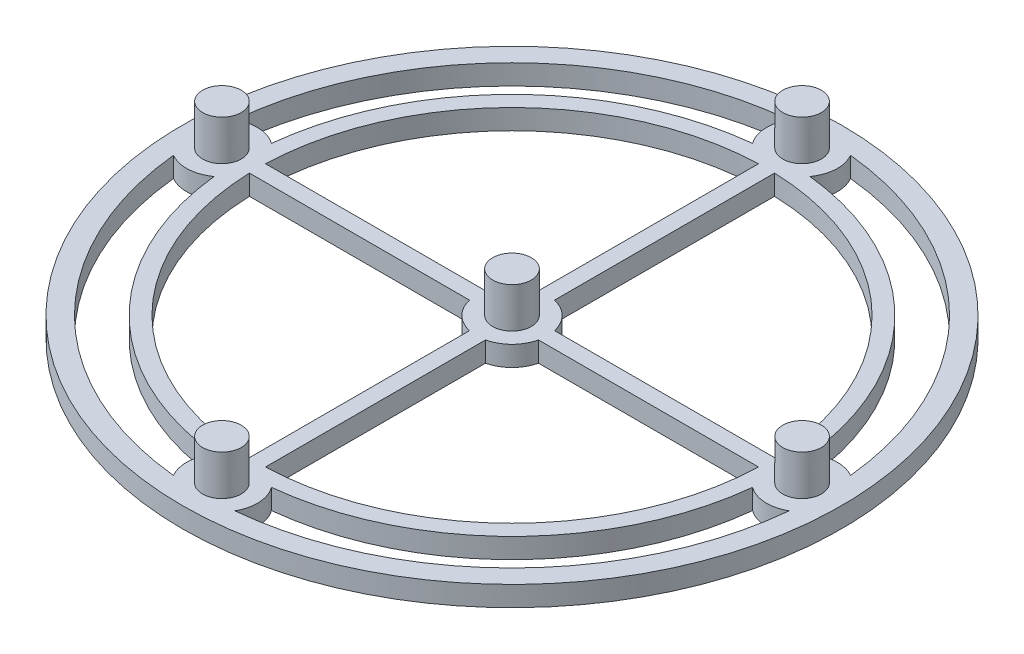
from build123d import *

# Parameters (mm, degrees)
SKETCH1_R             = 4.8
BOSS_EXTRUDE1_DEPTH   = 15
BOSS_EXTRUDE1_2_DEPTH = 15
BOSS_EXTRUDE1_3_DEPTH = 15
BOSS_EXTRUDE1_4_DEPTH = 15
BOSS_EXTRUDE1_5_DEPTH = 15
SKETCH2_R             = 81.8
BOSS_EXTRUDE2_DEPTH   = 5


with BuildPart() as part:
    # Sketch1 → Boss-Extrude1 (new body)
    with BuildSketch(Plane(origin=(0, 0, 0), x_dir=(1, 0, 0), z_dir=(0, 1, 0))):
        with Locations((0, 72)):
            Circle(SKETCH1_R)
    extrude(amount=BOSS_EXTRUDE1_DEPTH)



with BuildPart() as body_2:
    # Sketch1 → Boss-Extrude1 2 (new body)
    with BuildSketch(Plane(origin=(0, 0, 0), x_dir=(1, 0, 0), z_dir=(0, 1, 0))):
        Circle(SKETCH1_R)
    extrude(amount=BOSS_EXTRUDE1_2_DEPTH)


with BuildPart() as body_3:
    # Sketch1 → Boss-Extrude1 3 (new body)
    with BuildSketch(Plane(origin=(0, 0, 0), x_dir=(1, 0, 0), z_dir=(0, 1, 0))):
        with Locations((72, 0)):
            Circle(SKETCH1_R)
    extrude(amount=BOSS_EXTRUDE1_3_DEPTH)


with BuildPart() as body_4:
    # Sketch1 → Boss-Extrude1 4 (new body)
    with BuildSketch(Plane(origin=(0, 0, 0), x_dir=(1, 0, 0), z_dir=(0, 1, 0))):
        with Locations((0, -72)):
            Circle(SKETCH1_R)
    extrude(amount=BOSS_EXTRUDE1_4_DEPTH)


with BuildPart() as body_5:
    # Sketch1 → Boss-Extrude1 5 (new body)
    with BuildSketch(Plane(origin=(0, 0, 0), x_dir=(1, 0, 0), z_dir=(0, 1, 0))):
        with Locations((-72, 0)):
            Circle(SKETCH1_R)
    extrude(amount=BOSS_EXTRUDE1_5_DEPTH)


with BuildPart() as part_1:
    add(part.part)

    add(body_2.part)  # Boss-Extrude2 merges body 2

    add(body_3.part)  # Boss-Extrude2 merges body 3

    add(body_4.part)  # Boss-Extrude2 merges body 4

    add(body_5.part)  # Boss-Extrude2 merges body 5
    # Sketch2 → Boss-Extrude2 (add)
    with BuildSketch(Plane.XZ):
        Circle(SKETCH2_R)
        with BuildLine():
            Line((-2, 8.569714114), (-2, 63.168346504))
            ThreePointArc((-2, 63.168346504), (-44.689148571, 44.689148571), (-63.168346504, 2))
            Line((-63.168346504, 2), (-8.569714114, 2))
            ThreePointArc((-8.569714114, 2), (-6.222539674, 6.222539674), (-2, 8.569714114))
        make_face(mode=Mode.SUBTRACT)
        with BuildLine():
            Line((2, 8.569714114), (2, 63.168346504))
            ThreePointArc((2, 63.168346504), (44.689148571, 44.689148571), (63.168346504, 2))
            Line((63.168346504, 2), (8.569714114, 2))
            ThreePointArc((8.569714114, 2), (6.222539674, 6.222539674), (2, 8.569714114))
        make_face(mode=Mode.SUBTRACT)
        with BuildLine():
            Line((8.569714114, -2), (63.168346504, -2))
            ThreePointArc((63.168346504, -2), (44.689148571, -44.689148571), (2, -63.168346504))
            Line((2, -63.168346504), (2, -8.569714114))
            ThreePointArc((2, -8.569714114), (6.222539674, -6.222539674), (8.569714114, -2))
        make_face(mode=Mode.SUBTRACT)
        with BuildLine():
            Line((-2, -8.569714114), (-2, -63.168346504))
            ThreePointArc((-2, -63.168346504), (-44.689148571, -44.689148571), (-63.168346504, -2))
            Line((-63.168346504, -2), (-8.569714114, -2))
            ThreePointArc((-8.569714114, -2), (-6.222539674, -6.222539674), (-2, -8.569714114))
        make_face(mode=Mode.SUBTRACT)
        with BuildLine():
            ThreePointArc((76.422222222, 7.608150276), (71.549015158, 8.788436304), (66.822222222, 7.115519467))
            ThreePointArc((66.822222222, 7.115519467), (47.517575696, 47.517575696), (7.115519467, 66.822222222))
            ThreePointArc((7.115519467, 66.822222222), (8.788436304, 71.549015158), (7.608150276, 76.422222222))
            ThreePointArc((7.608150276, 76.422222222), (54.305800795, 54.305800795), (76.422222222, 7.608150276))
        make_face(mode=Mode.SUBTRACT)
        with BuildLine():
            ThreePointArc((-7.115519467, 66.822222222), (-47.517575696, 47.517575696), (-66.822222222, 7.115519467))
            ThreePointArc((-66.822222222, 7.115519467), (-71.549015158, 8.788436304), (-76.422222222, 7.608150276))
            ThreePointArc((-76.422222222, 7.608150276), (-54.305800795, 54.305800795), (-7.608150276, 76.422222222))
            ThreePointArc((-7.608150276, 76.422222222), (-8.788436304, 71.549015158), (-7.115519467, 66.822222222))
        make_face(mode=Mode.SUBTRACT)
        with BuildLine():
            ThreePointArc((7.608150276, -76.422222222), (8.788436304, -71.549015158), (7.115519467, -66.822222222))
            ThreePointArc((7.115519467, -66.822222222), (47.517575696, -47.517575696), (66.822222222, -7.115519467))
            ThreePointArc((66.822222222, -7.115519467), (71.549015158, -8.788436304), (76.422222222, -7.608150276))
            ThreePointArc((76.422222222, -7.608150276), (54.305800795, -54.305800795), (7.608150276, -76.422222222))
        make_face(mode=Mode.SUBTRACT)
        with BuildLine():
            ThreePointArc((-76.422222222, -7.608150276), (-71.549015158, -8.788436304), (-66.822222222, -7.115519467))
            ThreePointArc((-66.822222222, -7.115519467), (-47.517575696, -47.517575696), (-7.115519467, -66.822222222))
            ThreePointArc((-7.115519467, -66.822222222), (-8.788436304, -71.549015158), (-7.608150276, -76.422222222))
            ThreePointArc((-7.608150276, -76.422222222), (-54.305800795, -54.305800795), (-76.422222222, -7.608150276))
        make_face(mode=Mode.SUBTRACT)
    extrude(amount=-BOSS_EXTRUDE2_DEPTH)


solid = part_1.part
